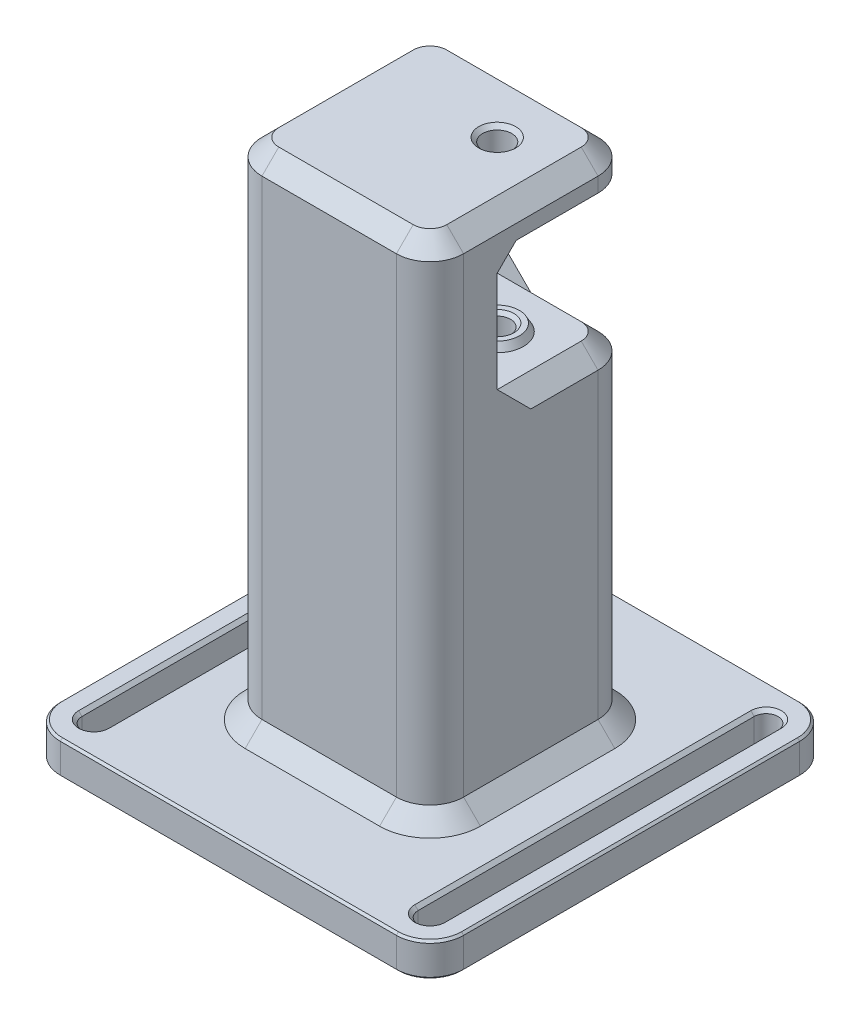
from build123d import *

# Parameters (mm, degrees)
SKETCH1_W                            = 76.2
SKETCH1_H                            = 76.2
BOSS_EXTRUDE1_DEPTH                  = 6.35
SKETCH2_W                            = 38.1
SKETCH2_H                            = 38.1
BOSS_EXTRUDE2_DEPTH                  = 69.85
BOSS_EXTRUDE3_DEPTH                  = 95.25
BOSS_EXTRUDE4_START                  = 95.25
SKETCH2_5_W                          = 25.4
SKETCH2_5_H                          = 25.4
SKETCH2_5_R                          = 4.175
BOSS_EXTRUDE4_DEPTH                  = 6.35
BOSS_EXTRUDE6_START                  = 93.9
SKETCH2_7_R                          = 4.175
BOSS_EXTRUDE6_DEPTH                  = 1.35
BOSS_EXTRUDE6_DRAFT                  = -30
F_8_0_199_DIAMETER_HOLE1_D           = 5.0546
F_8_0_199_DIAMETER_HOLE1_DEPTH       = 8.89
F_8_0_199_DIAMETER_HOLE1_CSINK_D     = 6.3246
F_8_0_199_DIAMETER_HOLE1_CSINK_ANGLE = 90
F_8_0_199_DIAMETER_HOLE1_TIP         = 1.518555042
F_8_START                            = -31.75
F_8_CLEARANCE_SLOT1_DEPTH            = 63.5
FILLET2_R                            = 6.35
CHAMFER2_SIZE                        = 3.175
CHAMFER3_SIZE                        = 3.175
CHAMFER4_SIZE                        = 0.396875


with BuildPart() as part:
    # Sketch1 → Boss-Extrude1 (new body)
    with BuildSketch(Plane(origin=(0, 0, 0), x_dir=(1, 0, 0), z_dir=(0, 1, 0))):
        Rectangle(SKETCH1_W, SKETCH1_H)
    extrude(amount=BOSS_EXTRUDE1_DEPTH)

    # Sketch2 → Boss-Extrude2 (add)
    with BuildSketch(Plane(origin=(0, 0, 0), x_dir=(1, 0, 0), z_dir=(0, 1, 0))):
        Rectangle(SKETCH2_W, SKETCH2_H)
    extrude(amount=BOSS_EXTRUDE2_DEPTH)

    # Sketch2<3> → Boss-Extrude3 (add)
    with BuildSketch(Plane(origin=(0, 0, 0), x_dir=(1, 0, 0), z_dir=(0, 1, 0))):
        Polygon((-19.05, 19.05), (-19.05, -19.05), (19.05, -19.05), (19.05, -6.35), (-6.35, -6.35), (-6.35, 19.05), align=None)
    extrude(amount=BOSS_EXTRUDE3_DEPTH)

    # Sketch2<5> → Boss-Extrude4 (add)
    # profile 1 of 3: a face of its own
    with BuildSketch(Plane(origin=(0, 0, 0), x_dir=(1, 0, 0), z_dir=(0, 1, 0)).offset(BOSS_EXTRUDE4_START)):
        Polygon((-19.05, 19.05), (-19.05, -19.05), (19.05, -19.05), (19.05, -6.35), (-6.35, -6.35), (-6.35, 19.05), align=None)
    # profile 2 of 3: a face of its own
    with BuildSketch(Plane(origin=(0, 0, 0), x_dir=(1, 0, 0), z_dir=(0, 1, 0)).offset(BOSS_EXTRUDE4_START)):
        with Locations((6.35, 6.35)):
            Rectangle(SKETCH2_5_W, SKETCH2_5_H)
        with Locations((6.35, 6.35)):
            Circle(SKETCH2_5_R, mode=Mode.SUBTRACT)
    # profile 3 of 3: a face of its own
    with BuildSketch(Plane(origin=(0, 0, 0), x_dir=(1, 0, 0), z_dir=(0, 1, 0)).offset(BOSS_EXTRUDE4_START)):
        with Locations((6.35, 6.35)):
            Circle(SKETCH2_5_R)
    extrude(amount=BOSS_EXTRUDE4_DEPTH)

    # Boss-Extrude5: read off the stored shape, not the designer's step
    # Boss-Extrude5 outline → Boss-Extrude5 (revolve)
    with BuildSketch(Plane(origin=(6.35, 0, -6.35), x_dir=(1, 0, 0), z_dir=(0, 0, 1))):
        Polygon((4.175, 71.2), (0, 71.2), (0, 69.85), (4.954422863, 69.85), align=None)
    revolve(axis=Axis((6.35, 0, -6.35), (0, 1, 0)))


with BuildPart() as boss_extrude6_tool:
    # Sketch2<7> → Boss-Extrude6 (with draft: the straight prism first)
    with BuildSketch(Plane(origin=(0, 0, 0), x_dir=(1, 0, 0), z_dir=(0, 1, 0)).offset(BOSS_EXTRUDE6_START)):
        with Locations((6.35, 6.35)):
            Circle(SKETCH2_7_R)
    extrude(amount=BOSS_EXTRUDE6_DEPTH)
    # Boss-Extrude6: the draft: its side faces are tilted about the plane it starts from
    boss_extrude6_sides = [boss_extrude6_tool.faces().sort_by_distance(p)[0] for p in [
        (2.175, 94.575, -6.35),
    ]]
    draft(boss_extrude6_sides, Plane(origin=(0, 0, 0), x_dir=(1, 0, 0), z_dir=(0, 1, 0)).offset(BOSS_EXTRUDE6_START), BOSS_EXTRUDE6_DRAFT)


with BuildPart() as part_1:
    add(part.part)

    # Boss-Extrude6: add boss_extrude6_tool
    add(boss_extrude6_tool.part)

    # #8 (0.199) Diameter Hole1
    with Locations(Plane(origin=(0, 71.2, 0), x_dir=(1, 0, 0), z_dir=(0, 1, 0))):
        with Locations((6.35, 6.35)):
            CounterSinkHole(F_8_0_199_DIAMETER_HOLE1_D / 2, F_8_0_199_DIAMETER_HOLE1_CSINK_D / 2, depth=F_8_0_199_DIAMETER_HOLE1_DEPTH, counter_sink_angle=F_8_0_199_DIAMETER_HOLE1_CSINK_ANGLE)
            with Locations((0, 0, -(F_8_0_199_DIAMETER_HOLE1_DEPTH + F_8_0_199_DIAMETER_HOLE1_TIP / 2))):  # 118° drill point
                Cone(0, F_8_0_199_DIAMETER_HOLE1_D / 2, F_8_0_199_DIAMETER_HOLE1_TIP, mode=Mode.SUBTRACT)

    # Sketch8 → M5 Clearance Hole1 (revolve, cut)
    with BuildSketch(Plane(origin=(6.35, 93.9, -6.35), x_dir=(0, 0, -1), z_dir=(1, 0, 0))):
        Polygon((0, 0), (0, 7.7), (3.5, 7.7), (2.75, 6.95), (2.75, 0.75), (3.5, 0), align=None)
    revolve(axis=Axis((6.35, 87.55, -6.35), (0, 1, 0)), mode=Mode.SUBTRACT)

    # #8 Clearance Slot1: read off the stored shape, not the designer's step
    # #8 Clearance Slot1 outline → #8 Clearance Slot1 (cut)
    with BuildSketch(Plane.XY.offset(F_8_START)):
        Polygon((34.6329, 6.35), (28.8671, 6.35), (29.5021, 5.715), (29.5021, 0.635), (28.8671, 0), (34.6329, 0), (33.9979, 0.635), (33.9979, 5.715), align=None)
        Polygon((-29.5021, 5.715), (-28.8671, 6.35), (-34.6329, 6.35), (-33.9979, 5.715), (-33.9979, 0.635), (-34.6329, 0), (-28.8671, 0), (-29.5021, 0.635), align=None)
    extrude(amount=F_8_CLEARANCE_SLOT1_DEPTH, mode=Mode.SUBTRACT)

    # 8 Clearance Slot1 2 outline → 8 Clearance Slot1 2 (revolve, cut)
    with BuildSketch(Plane(origin=(31.75, 0, -31.75), x_dir=(1, 0, 0), z_dir=(0, 0, 1))):
        Polygon((0, 0), (2.8829, 0), (2.2479, 0.635), (2.2479, 5.715), (2.8829, 6.35), (0, 6.35), align=None)
    revolve(axis=Axis((31.75, 0, -31.75), (0, 1, 0)), mode=Mode.SUBTRACT)

    # 8 Clearance Slot1 3 outline → 8 Clearance Slot1 3 (revolve, cut)
    with BuildSketch(Plane(origin=(31.75, 0, 31.75), x_dir=(1, 0, 0), z_dir=(0, 0, 1))):
        Polygon((0, 0), (2.8829, 0), (2.2479, 0.635), (2.2479, 5.715), (2.8829, 6.35), (0, 6.35), align=None)
    revolve(axis=Axis((31.75, 0, 31.75), (0, 1, 0)), mode=Mode.SUBTRACT)

    # 8 Clearance Slot1 4 outline → 8 Clearance Slot1 4 (revolve, cut)
    with BuildSketch(Plane(origin=(-31.75, 0, -31.75), x_dir=(1, 0, 0), z_dir=(0, 0, 1))):
        Polygon((0, 0), (2.8829, 0), (2.2479, 0.635), (2.2479, 5.715), (2.8829, 6.35), (0, 6.35), align=None)
    revolve(axis=Axis((-31.75, 0, -31.75), (0, 1, 0)), mode=Mode.SUBTRACT)

    # 8 Clearance Slot1 5 outline → 8 Clearance Slot1 5 (revolve, cut)
    with BuildSketch(Plane(origin=(-31.75, 0, 31.75), x_dir=(1, 0, 0), z_dir=(0, 0, 1))):
        Polygon((0, 0), (2.8829, 0), (2.2479, 0.635), (2.2479, 5.715), (2.8829, 6.35), (0, 6.35), align=None)
    revolve(axis=Axis((-31.75, 0, 31.75), (0, 1, 0)), mode=Mode.SUBTRACT)

    # Fillet2
    fillet2_edges = [part_1.edges().sort_by_distance(p)[0] for p in [
        (19.05, 38.1, -19.05),
        (-19.05, 53.975, -19.05),
        (-19.05, 53.975, 19.05),
        (19.05, 53.975, 19.05),
        (-6.35, 82.55, 6.35),
        (19.05, 98.425, -19.05),
        (38.1, 3.175, 38.1),
        (-38.1, 3.175, 38.1),
        (-38.1, 3.175, -38.1),
        (38.1, 3.175, -38.1),
    ]]
    fillet(fillet2_edges, radius=FILLET2_R)

    # Chamfer2
    chamfer2_edges = [part_1.edges().sort_by_distance(p)[0] for p in [
        (-6.35, 69.85, -9.525),
        (9.525, 69.85, 6.35),
        (-4.490128061, 69.85, 4.490128061),
        (-4.490128061, 95.25, 4.490128061),
        (-19.05, 6.35, 0),
        (0, 6.35, -19.05),
        (19.05, 6.35, 0),
        (0, 6.35, 19.05),
        (-17.190128061, 6.35, -17.190128061),
        (17.190128061, 6.35, -17.190128061),
        (-17.190128061, 6.35, 17.190128061),
        (17.190128061, 6.35, 17.190128061),
        (-6.35, 95.25, -9.525),
        (9.525, 95.25, 6.35),
    ]]
    chamfer(chamfer2_edges, length=CHAMFER2_SIZE)

    # Chamfer3
    chamfer3_edges = [part_1.edges().sort_by_distance(p)[0] for p in [
        (17.190128061, 69.85, -17.190128061),
        (0, 101.6, -19.05),
        (19.05, 101.6, 0),
        (-19.05, 101.6, 0),
        (0, 101.6, 19.05),
        (17.190128061, 101.6, 17.190128061),
        (-17.190128061, 101.6, 17.190128061),
        (-17.190128061, 101.6, -17.190128061),
        (17.190128061, 101.6, -17.190128061),
        (19.05, 69.85, -4.7625),
        (4.7625, 69.85, -19.05),
    ]]
    chamfer(chamfer3_edges, length=CHAMFER3_SIZE)

    # Chamfer4
    chamfer4_edges = [part_1.edges().sort_by_distance(p)[0] for p in [
        (4.7625, 95.25, -19.05),
        (19.05, 95.25, -4.7625),
        (17.190128061, 95.25, -17.190128061),
        (-38.1, 0, 0),
        (-38.1, 6.35, 0),
        (38.1, 0, 0),
        (0, 0, 38.1),
        (0, 0, -38.1),
        (36.240128061, 0, -36.240128061),
        (36.240128061, 0, 36.240128061),
        (-36.240128061, 0, 36.240128061),
        (-36.240128061, 0, -36.240128061),
        (0, 6.35, -38.1),
        (38.1, 6.35, 0),
        (0, 6.35, 38.1),
        (36.240128061, 6.35, -36.240128061),
        (36.240128061, 6.35, 36.240128061),
        (-36.240128061, 6.35, 36.240128061),
        (-36.240128061, 6.35, -36.240128061),
    ]]
    chamfer(chamfer4_edges, length=CHAMFER4_SIZE)


solid = part_1.part
